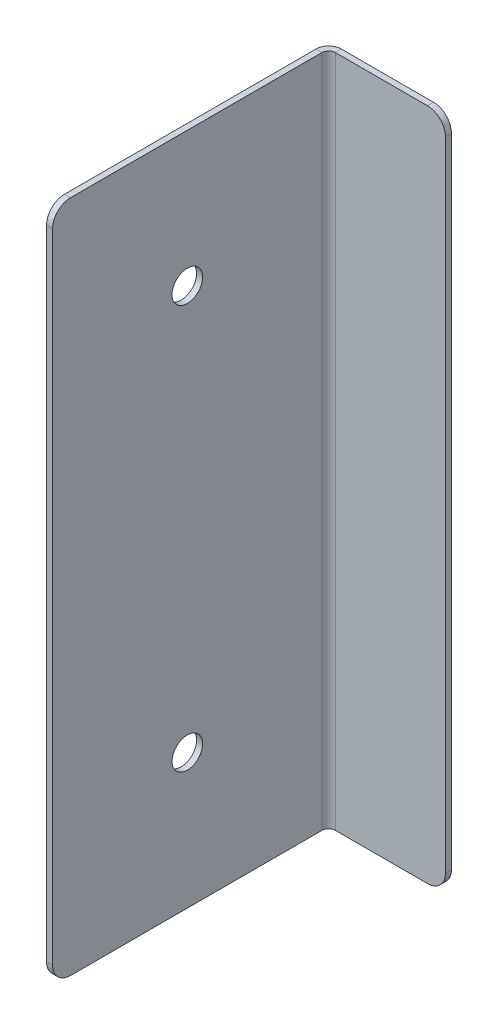
from build123d import *

# Parameters (mm, degrees)
SKETCH1_W          = 30
SKETCH1_H          = 75
BASE_FLANGE1_DEPTH = 0.67
EDGE_FLANGE1_DEPTH = 75
SKETCH7_R          = 1.7
CUT_EXTRUDE1_DEPTH = 10
FILLET1_R          = 2


# Sheet-metal steps are written as plain solids
with BuildPart() as part:
    # Sketch1 → Base-Flange1 (new body)
    with BuildSketch(Plane(origin=(0, 0, 0), x_dir=(0, 0, -1), z_dir=(1, 0, 0))):
        with Locations((15, -37.5)):
            Rectangle(SKETCH1_W, SKETCH1_H)
    extrude(amount=-BASE_FLANGE1_DEPTH)

    # Edge-Flange1 section (across the edge) → Edge-Flange1 (add)
    with BuildSketch(Plane(origin=(0, -75, -30.7366), x_dir=(0, 0, 1), z_dir=(0, 1, 0))):
        with BuildLine():
            Line((-0.67, 0.7366), (-0.67, 13))
            Line((-0.67, 13), (0, 13))
            Line((0, 13), (0, 0.7366))
            ThreePointArc((0, 0.7366), (0.215745145, 0.215745145), (0.7366, 0))
            Line((0.7366, 0), (0.7366, -0.67))
            ThreePointArc((0.7366, -0.67), (-0.258016398, -0.258016398), (-0.67, 0.7366))
        make_face()
    extrude(amount=EDGE_FLANGE1_DEPTH)

    # Sketch7 → Cut-Extrude1 (cut)
    with BuildSketch(Plane(origin=(0, 0, 0), x_dir=(0, 0, -1), z_dir=(1, 0, 0))):
        with Locations((15, -60)):
            Circle(SKETCH7_R)
        with Locations((15, -15)):
            Circle(SKETCH7_R)
    extrude(amount=-CUT_EXTRUDE1_DEPTH, mode=Mode.SUBTRACT)

    # Fillet1
    fillet1_edges = [part.edges().sort_by_distance(p)[0] for p in [
        (13, -75, -31.0716),
        (13, 0, -31.0716),
        (-0.335, 0, 0),
        (-0.335, -75, 0),
    ]]
    fillet(fillet1_edges, radius=FILLET1_R)


solid = part.part
